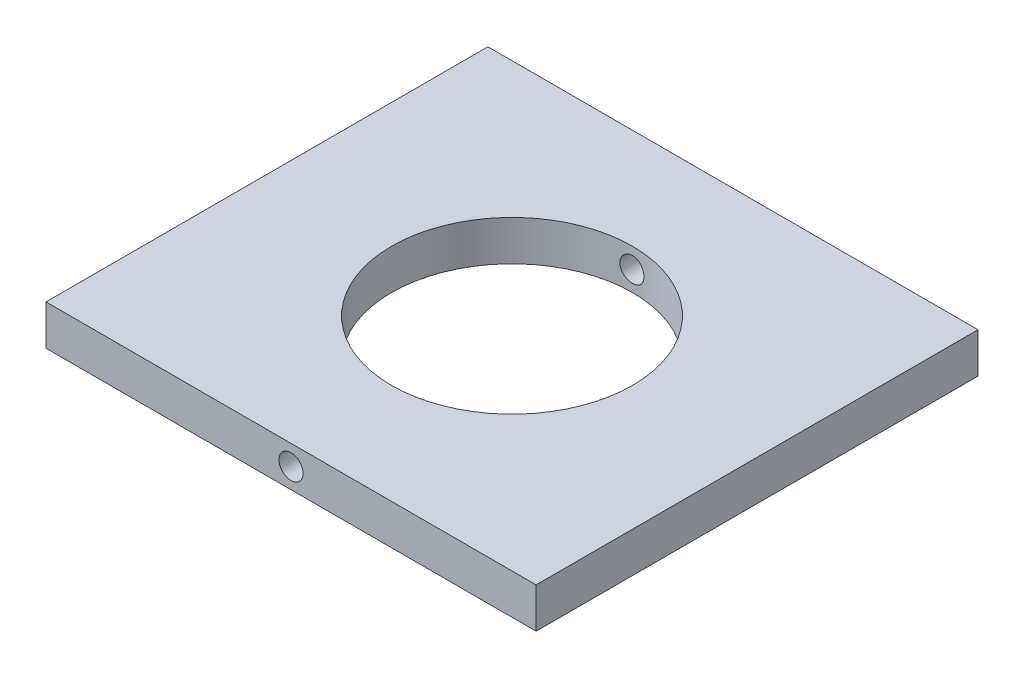
from build123d import *

# Parameters (mm, degrees)
ESQUISSE1_W             = 61
ESQUISSE1_H             = 5
BOSS_EXTRU_1_DEPTH      = 55
ESQUISSE2_R             = 15
ENL_V_MAT_EXTRU_1_DEPTH = 77.198753271
ESQUISSE5_R             = 1.5
ENL_V_MAT_EXTRU_4_DEPTH = 92.001373616


with BuildPart() as part:
    # Esquisse1 → Boss.-Extru.1 (new body)
    with BuildSketch(Plane.XY):
        with Locations((22, -47.5)):
            Rectangle(ESQUISSE1_W, ESQUISSE1_H)
    extrude(amount=BOSS_EXTRU_1_DEPTH)

    # Esquisse2 → Enlèv. mat.-Extru.1 (cut, through all)
    with BuildSketch(Plane(origin=(0, -45, 0), x_dir=(-1, 0, 0), z_dir=(0, 1, 0))):
        with Locations((-22, 27.5)):
            Circle(ESQUISSE2_R)
    extrude(amount=-ENL_V_MAT_EXTRU_1_DEPTH, mode=Mode.SUBTRACT)

    # Esquisse5 → Enlèv. mat.-Extru.4 (cut, through all)
    with BuildSketch(Plane.XY.offset(55)):
        with Locations((22, -47.5)):
            Circle(ESQUISSE5_R)
    extrude(amount=-ENL_V_MAT_EXTRU_4_DEPTH, mode=Mode.SUBTRACT)


solid = part.part
